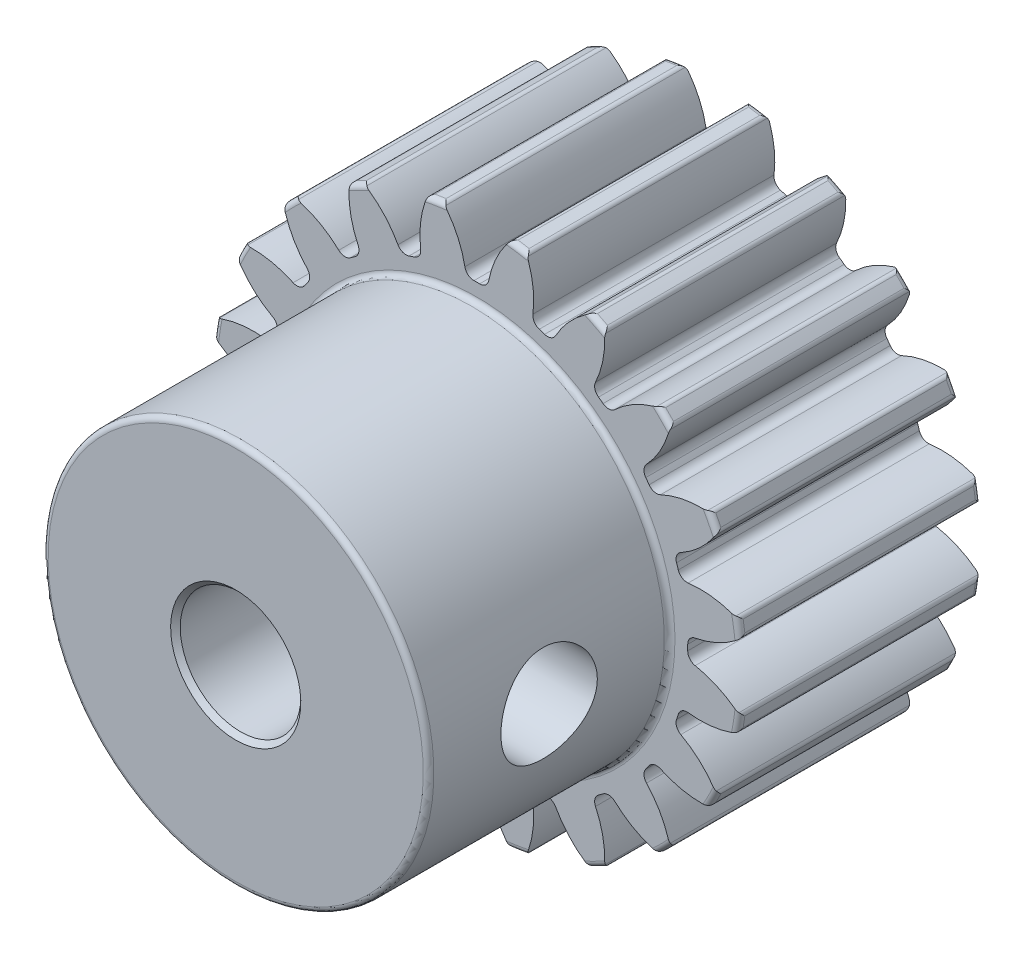
from build123d import *

# Parameters (mm, degrees)
FILLET2_R                = 0.22
CUT_EXTRUDE2_DEPTH       = 19.493242122
FILLET3_R                = 0.380000002
FILLET4_START            = -1
FILLET4_DEPTH            = 12
CIRPATTERN1_COUNT        = 20
FILLET3_OF_CIRPATTERN1_R = 0.380000002
CUT_EXTRUDE3_REACH       = 31.598
CUT_EXTRUDE3_END_RADIUS  = 2.5
SKETCH8_R                = 2
CHAMFER1_SIZE            = 0.2


with BuildPart() as part:
    # Sketch4 → Revolve1 (revolve)
    with BuildSketch(Plane(origin=(0, 0, 0), x_dir=(0, 0, -1), z_dir=(1, 0, 0))):
        Polygon((-20, 2.5), (-20, 8), (-10, 8), (-10, 11), (0, 11), (0, 2.5), align=None)
    revolve(axis=Axis((0, 0, 10), (0, 0, 1)))

    # Fillet2
    fillet2_edges = [part.edges().sort_by_distance(p)[0] for p in [
        (0, -11, 0),
        (0, -11, 10),
        (0, -8, 10),
        (0, -8, 20),
    ]]
    fillet(fillet2_edges, radius=FILLET2_R)

    # Sketch7 → Cut-Extrude2 (cut, through all)
    with BuildSketch(Plane.XY.offset(10)):
        with BuildLine():
            ThreePointArc((-1.386317671, 10.912292303), (0, 11), (1.386317671, 10.912292303))
            ThreePointArc((1.386317671, 10.912292303), (0.752334809, 9.896489116), (0.447415862, 8.738553529))
            ThreePointArc((0.447415862, 8.738553529), (0, 8.749999928), (-0.447415862, 8.738553529))
            ThreePointArc((-0.447415862, 8.738553529), (-0.752334809, 9.896489116), (-1.386317671, 10.912292303))
        make_face()
    cut_extrude2 = extrude(amount=-CUT_EXTRUDE2_DEPTH, mode=Mode.SUBTRACT)

    # Fillet3
    fillet3_edges = [part.edges().sort_by_distance(p)[0] for p in [
        (-0.447415862, 8.738553529, 5),
        (0.447415862, 8.738553529, 5),
    ]]
    fillet(fillet3_edges, radius=FILLET3_R)

    # Fillet4: read off the stored shape, not the designer's step
    # Fillet4 outline → Fillet4 (cut)
    with BuildSketch(Plane.XY.offset(FILLET4_START)):
        with BuildLine():
            ThreePointArc((-1.386317671, 10.912292303), (-1.438668396, 10.905513891), (-1.49098599, 10.898484334))
            ThreePointArc((-1.49098599, 10.898484334), (-1.395337106, 10.886914385), (-1.317660797, 10.829914703))
            ThreePointArc((-1.317660797, 10.829914703), (-1.351714801, 10.871335562), (-1.386317671, 10.912292303))
        make_face()
        with BuildLine():
            ThreePointArc((1.317660797, 10.829914703), (1.395337106, 10.886914385), (1.49098599, 10.898484334))
            ThreePointArc((1.49098599, 10.898484334), (1.438668396, 10.905513891), (1.386317671, 10.912292303))
            ThreePointArc((1.386317671, 10.912292303), (1.351714801, 10.871335562), (1.317660797, 10.829914703))
        make_face()
    fillet4 = extrude(amount=FILLET4_DEPTH, mode=Mode.SUBTRACT)

    # CirPattern1: Cut-Extrude2, Fillet4 ×20 about axis
    cirpattern1_axis = Axis((0, 0, 0), (0, 0, 1))
    add([cut_extrude2.rotate(cirpattern1_axis, i * 360 / CIRPATTERN1_COUNT) for i in range(1, CIRPATTERN1_COUNT)], mode=Mode.SUBTRACT)
    add([fillet4.rotate(cirpattern1_axis, i * 360 / CIRPATTERN1_COUNT) for i in range(1, CIRPATTERN1_COUNT)], mode=Mode.SUBTRACT)

    # Fillet3 of CirPattern1
    fillet3_of_cirpattern1_edges = [part.edges().sort_by_distance(p)[0] for p in [
        (-3.125879318, 8.172599172, 5),
        (-2.274843776, 8.449117382, 5),
        (-5.498359927, 6.806653866, 5),
        (-4.774425855, 7.332622757, 5),
        (-7.332622757, 4.774425855, 5),
        (-6.806653866, 5.498359927, 5),
        (-8.449117382, 2.274843776, 5),
        (-8.172599172, 3.125879318, 5),
        (-8.738553529, -0.447415862, 5),
        (-8.738553529, 0.447415862, 5),
        (-8.172599172, -3.125879318, 5),
        (-8.449117382, -2.274843776, 5),
        (-6.806653866, -5.498359927, 5),
        (-7.332622757, -4.774425855, 5),
        (-4.774425855, -7.332622757, 5),
        (-5.498359927, -6.806653866, 5),
        (-2.274843776, -8.449117382, 5),
        (-3.125879318, -8.172599172, 5),
        (0.447415862, -8.738553529, 5),
        (-0.447415862, -8.738553529, 5),
        (3.125879318, -8.172599172, 5),
        (2.274843776, -8.449117382, 5),
        (5.498359927, -6.806653866, 5),
        (4.774425855, -7.332622757, 5),
        (7.332622757, -4.774425855, 5),
        (6.806653866, -5.498359927, 5),
        (8.449117382, -2.274843776, 5),
        (8.172599172, -3.125879318, 5),
        (8.738553529, 0.447415862, 5),
        (8.738553529, -0.447415862, 5),
        (8.172599172, 3.125879318, 5),
        (8.449117382, 2.274843776, 5),
        (6.806653866, 5.498359927, 5),
        (7.332622757, 4.774425855, 5),
        (4.774425855, 7.332622757, 5),
        (5.498359927, 6.806653866, 5),
        (2.274843776, 8.449117382, 5),
        (3.125879318, 8.172599172, 5),
    ]]
    fillet(fillet3_of_cirpattern1_edges, radius=FILLET3_OF_CIRPATTERN1_R)

    # Cut-Extrude3: up to this cylinder (the profile starts outside it)
    cut_extrude3_end = Plane(origin=(0, 0, 15), z_dir=(0, 0, -1)) * Cylinder(CUT_EXTRUDE3_END_RADIUS, 69.196, mode=Mode.PRIVATE)
    # Sketch8 → Cut-Extrude3 (cut, up to the surface)
    with BuildSketch(Plane(origin=(8, 0, 0), x_dir=(0, 0, -1), z_dir=(1, 0, 0)), mode=Mode.PRIVATE) as cut_extrude3_sk1:
        with Locations((-15, 0)):
            Circle(SKETCH8_R)
    cut_extrude3_tool1 = extrude(cut_extrude3_sk1.sketch, amount=-CUT_EXTRUDE3_REACH, mode=Mode.PRIVATE) - cut_extrude3_end
    add(cut_extrude3_tool1.solids().sort_by_distance((8, 0, 15))[0], mode=Mode.SUBTRACT)

    # Chamfer1
    chamfer1_edges = [part.edges().sort_by_distance(p)[0] for p in [
        (0, -2.5, 0),
        (0, -2.5, 20),
    ]]
    chamfer(chamfer1_edges, length=CHAMFER1_SIZE)


solid = part.part
